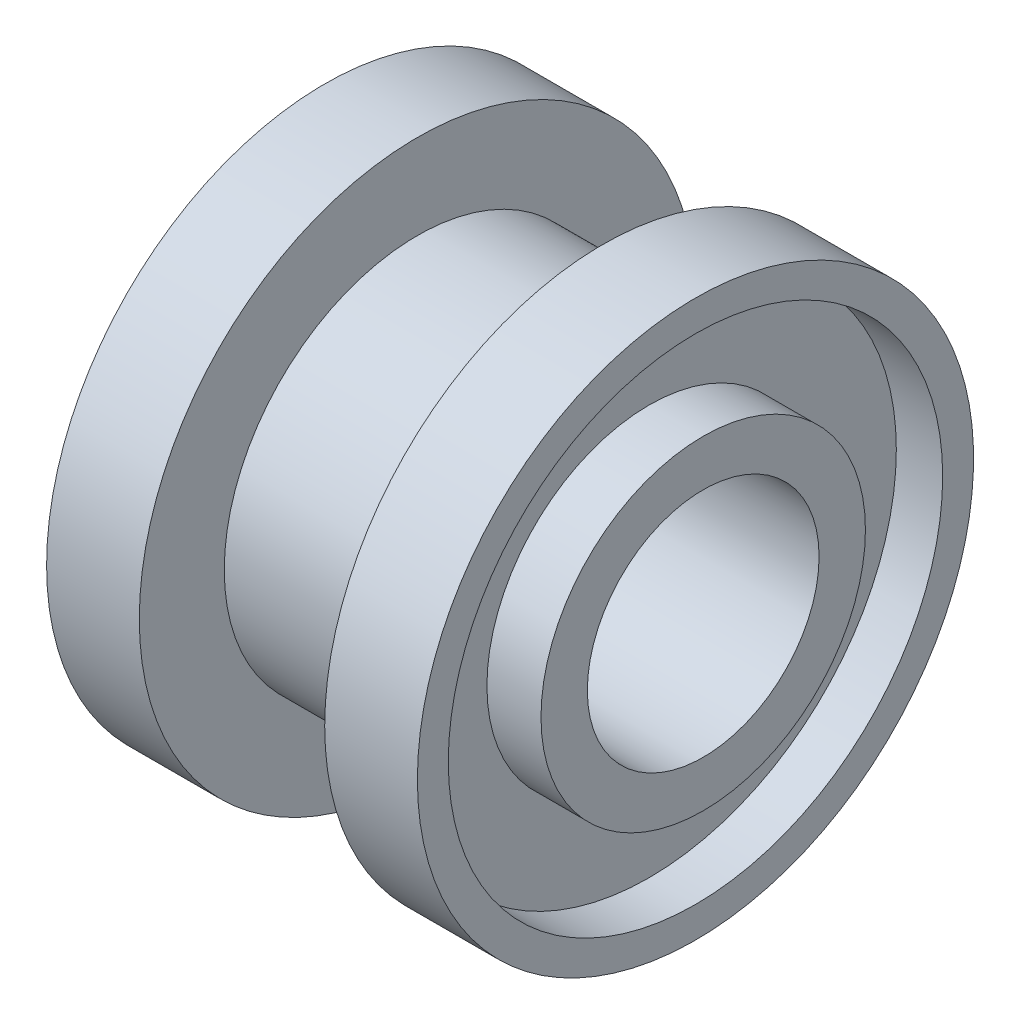
from build123d import *

# Parameters (mm, degrees)
SZKIC2_R                   = 0.5
WYTNIJ_WYCI_GNI_CIE1_DEPTH = 1


with BuildPart() as part:
    # Szkic1 → Obrót1 (revolve)
    with BuildSketch(Plane.XY):
        Polygon((-6, 12.5), (6, 12.5), (6, 18), (12, 18), (12, 16), (9, 16), (9, 10.5), (12.5, 10.5), (12.5, 7.5), (-12.5, 7.5), (-12.5, 10.5), (-9, 10.5), (-9, 16), (-12, 16), (-12, 18), (-6, 18), align=None)
    revolve(axis=Axis((-30.837457467, 0, 0), (1, 0, 0)))

    # Szkic2 → Wytnij-wyciągnięcie1 (cut)
    with BuildSketch(Plane.ZY.offset(12)):
        with Locations((0, 17)):
            Circle(SZKIC2_R)
    extrude(amount=-WYTNIJ_WYCI_GNI_CIE1_DEPTH, mode=Mode.SUBTRACT)


solid = part.part
